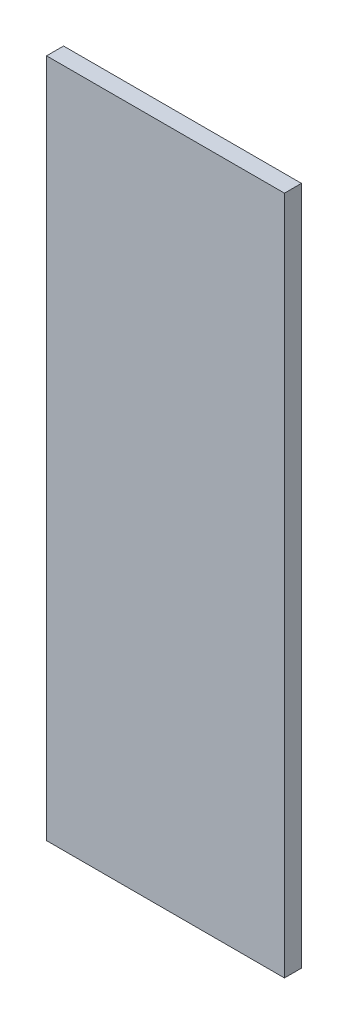
from build123d import *

# Parameters (mm, degrees)
SKETCH_1_W          = 100
SKETCH_1_H          = 200
EXTRUDE_1_DEPTH     = 5
CUT_EXTRUDE_2_DEPTH = 0.001
SKETCH_13_W         = 10
SKETCH_13_H         = 200
CUT_EXTRUDE_4_DEPTH = 10
SKETCH_14_W         = 10
SKETCH_14_H         = 200
CUT_EXTRUDE_5_DEPTH = 10


with BuildPart() as part:
    # 스케치1 → 보스-돌출1 (new body)
    with BuildSketch(Plane.XY):
        Rectangle(SKETCH_1_W, SKETCH_1_H)
    extrude(amount=EXTRUDE_1_DEPTH)

    # 스케치3 → 컷-돌출2 (cut)
    # profile 1 of 5: a face of its own
    with BuildSketch(Plane(origin=(0, 0, 0), x_dir=(-1, 0, 0), z_dir=(0, 0, -1))):
        with BuildLine():
            Line((1.435897436, 3.568709936), (1.435897436, 3.241987179))
            add(Edge.make_bspline(
                [(1.435897436, 3.241987179), (1.406158657, 3.253938052), (1.349713836, 3.276621056), (1.26647346, 3.301285681), (1.189944626, 3.317221421), (1.140790736, 3.319457366), (1.117588141, 3.320512821)],
                knots=[0, 0, 0, 0, 1.16548392, 2.212112691, 3.15604595, 4, 4, 4, 4], degree=3))
            add(Edge.make_bspline(
                [(1.117588141, 3.320512821), (1.101914377, 3.31986148), (1.071575198, 3.318600703), (1.027971871, 3.312172427), (0.988682661, 3.299069626), (0.953777041, 3.28204035), (0.924826581, 3.260686166), (0.900040357, 3.239230902), (0.882073827, 3.215045722), (0.872318879, 3.192525311), (0.866368878, 3.171674318), (0.86457875, 3.150320052), (0.860193836, 3.124095966), (0.858971029, 3.091932248), (0.856183661, 3.054829537), (0.856430302, 3.012002641), (0.854146379, 2.964125498), (0.854488293, 2.930224949), (0.854667468, 2.912459936)],
                knots=[0, 0, 0, 0, 1.311993654, 2.539582093, 3.670788641, 4.763509788, 5.772417512, 6.671800701, 7.496729179, 8.266799162, 8.712543678, 9.304149002, 10.05334463, 10.934920737, 11.99209668, 13.165090968, 14.514413552, 16, 16, 16, 16], degree=3))
            Line((0.854667468, 2.912459936), (0.854667468, 2.557692308))
            Line((0.854667468, 2.557692308), (1.391025641, 2.557692308))
            Line((1.391025641, 2.557692308), (1.391025641, 2.243589744))
            Line((1.391025641, 2.243589744), (0.853966346, 2.243589744))
            Line((0.853966346, 2.243589744), (0.852564103, 0))
            Line((0.852564103, 0), (0.538461538, 0))
            Line((0.538461538, 0), (0.538461538, 2.243589744))
            Line((0.538461538, 2.243589744), (0.179487179, 2.243589744))
            Line((0.179487179, 2.243589744), (0.179487179, 2.557692308))
            Line((0.179487179, 2.557692308), (0.538461538, 2.557692308))
            Line((0.538461538, 2.557692308), (0.538461538, 2.966446314))
            add(Edge.make_bspline(
                [(0.538461538, 2.966446314), (0.538486753, 2.989121894), (0.538535124, 3.032622798), (0.541922975, 3.095232239), (0.544818696, 3.153055703), (0.550586323, 3.205644336), (0.557248029, 3.253490479), (0.566784189, 3.29588336), (0.57579556, 3.333965119), (0.592144152, 3.377067776), (0.616566371, 3.4259178), (0.656096568, 3.4775417), (0.703489575, 3.523846647), (0.760097899, 3.562854), (0.823813434, 3.595269478), (0.894694612, 3.618511331), (0.97196981, 3.631651776), (1.02545728, 3.633605985), (1.053084936, 3.634615385)],
                knots=[0, 0, 0, 0, 1.116398763, 2.141702935, 3.087165306, 3.966655413, 4.746276475, 5.464069668, 6.106083417, 6.67047701, 7.730773247, 8.782666744, 9.856985883, 10.980834087, 12.154321827, 13.366232824, 14.639591414, 16, 16, 16, 16], degree=3))
            add(Edge.make_bspline(
                [(1.053084936, 3.634615385), (1.081161694, 3.633658004), (1.140107358, 3.631648034), (1.232303961, 3.619214627), (1.331900478, 3.597743597), (1.400236399, 3.578665712), (1.435897436, 3.568709936)],
                knots=[0, 0, 0, 0, 0.864728408, 1.815451418, 2.859995356, 4, 4, 4, 4], degree=3))
        make_face()
    # profile 2 of 5: a face of its own
    with BuildSketch(Plane(origin=(0, 0, 0), x_dir=(-1, 0, 0), z_dir=(0, 0, -1))):
        with BuildLine():
            Line((1.794871795, 2.557692308), (2.108974359, 2.557692308))
            Line((2.108974359, 2.557692308), (2.108974359, 2.181189904))
            add(Edge.make_bspline(
                [(2.108974359, 2.181189904), (2.132163118, 2.216245732), (2.176511439, 2.283289731), (2.250224368, 2.371959032), (2.325727699, 2.445374079), (2.403382887, 2.503877598), (2.483760987, 2.547690717), (2.565097938, 2.579783752), (2.648673408, 2.598761067), (2.704835332, 2.601294726), (2.732972756, 2.602564103)],
                knots=[0, 0, 0, 0, 1.2804753, 2.448899062, 3.506932113, 4.484331642, 5.4025378, 6.288909075, 7.142734305, 8, 8, 8, 8], degree=3))
            add(Edge.make_bspline(
                [(2.732972756, 2.602564103), (2.754799083, 2.601373576), (2.799708168, 2.59892399), (2.867690758, 2.581713165), (2.93773421, 2.554235143), (2.982876597, 2.52839492), (3.006410256, 2.514923878)],
                knots=[0, 0, 0, 0, 0.901110191, 1.854092781, 2.881294221, 4, 4, 4, 4], degree=3))
            Line((3.006410256, 2.514923878), (2.833934295, 2.242888622))
            add(Edge.make_bspline(
                [(2.833934295, 2.242888622), (2.818825274, 2.249628888), (2.790145459, 2.262423203), (2.748190893, 2.277565213), (2.709509556, 2.286481129), (2.684865998, 2.287831847), (2.673377404, 2.288461538)],
                knots=[0, 0, 0, 0, 1.180555205, 2.24091978, 3.179933427, 4, 4, 4, 4], degree=3))
            add(Edge.make_bspline(
                [(2.673377404, 2.288461538), (2.64817167, 2.286781501), (2.59675928, 2.283354712), (2.521274781, 2.256415904), (2.448027575, 2.212890664), (2.389855913, 2.164619552), (2.34481366, 2.118071755), (2.312673435, 2.077423352), (2.283190688, 2.031844721), (2.255020467, 1.982115037), (2.229354173, 1.927385191), (2.205399504, 1.868201977), (2.183740641, 1.804496849), (2.171390397, 1.760114328), (2.165064103, 1.737379808)],
                knots=[0, 0, 0, 0, 1.125678352, 2.296057538, 3.5422874, 4.923748041, 5.663163013, 6.437101912, 7.23742474, 8.08941207, 8.991984279, 9.93940061, 10.944477711, 12, 12, 12, 12], degree=3))
            add(Edge.make_bspline(
                [(2.165064103, 1.737379808), (2.160331709, 1.717102634), (2.149849818, 1.672190235), (2.13965828, 1.596841711), (2.129588762, 1.507818052), (2.122492143, 1.404871459), (2.115914101, 1.288259015), (2.112204019, 1.15780307), (2.109100878, 1.013369718), (2.109017812, 0.912395365), (2.108974359, 0.859575321)],
                knots=[0, 0, 0, 0, 0.566838948, 1.255505196, 2.06880316, 3.007127437, 4.065329342, 5.249902469, 6.561414163, 8, 8, 8, 8], degree=3))
            Line((2.108974359, 0.859575321), (2.108974359, 0))
            Line((2.108974359, 0), (1.794871795, 0))
            Line((1.794871795, 0), (1.794871795, 2.557692308))
        make_face()
    # profile 3 of 5: a face of its own
    with BuildSketch(Plane(origin=(0, 0, 0), x_dir=(-1, 0, 0), z_dir=(0, 0, -1))):
        with BuildLine():
            add(Edge.make_bspline(
                [(4.555889423, 2.602564103), (4.603880696, 2.601542211), (4.697979853, 2.599538533), (4.835787739, 2.578123567), (4.967332875, 2.545376203), (5.093119067, 2.500104641), (5.211535363, 2.43942269), (5.324306607, 2.367013399), (5.431123616, 2.281230805), (5.495146645, 2.214872737), (5.527644231, 2.181189904)],
                knots=[0, 0, 0, 0, 1.054011418, 2.066658804, 3.057071809, 4.030435133, 4.997543892, 5.974964718, 6.972108034, 8, 8, 8, 8], degree=3))
            add(Edge.make_bspline(
                [(5.527644231, 2.181189904), (5.555626185, 2.148975918), (5.611048565, 2.085171376), (5.682114284, 1.981715763), (5.743335844, 1.874575662), (5.792398805, 1.762328336), (5.831083829, 1.645953664), (5.858549525, 1.525051653), (5.87488646, 1.399889306), (5.877089427, 1.314885468), (5.878205128, 1.271834936)],
                knots=[0, 0, 0, 0, 1.025258237, 2.030674902, 3.01204498, 3.988269485, 4.97094183, 5.956517959, 6.965070386, 8, 8, 8, 8], degree=3))
            add(Edge.make_bspline(
                [(5.878205128, 1.271834936), (5.877223791, 1.228534878), (5.875284623, 1.142971945), (5.856941006, 1.016952579), (5.82840992, 0.894757756), (5.787578082, 0.776899063), (5.735219973, 0.663016235), (5.671329285, 0.553606686), (5.595457668, 0.448454553), (5.509453671, 0.348452714), (5.414401795, 0.2562865), (5.311285647, 0.17595823), (5.202131613, 0.107136706), (5.08548826, 0.05170029), (4.962420773, 0.00799059), (4.832663705, -0.022709427), (4.696418635, -0.04127111), (4.603391413, -0.043654684), (4.555889423, -0.044871795)],
                knots=[0, 0, 0, 0, 0.998656419, 1.973391657, 2.932242238, 3.890759089, 4.846373663, 5.82037756, 6.809684879, 7.83454468, 8.860553229, 9.859544525, 10.845671541, 11.83227036, 12.833544569, 13.85385346, 14.904124723, 16, 16, 16, 16], degree=3))
            add(Edge.make_bspline(
                [(4.555889423, -0.044871795), (4.508154704, -0.043650599), (4.414663844, -0.041258824), (4.277937862, -0.022781541), (4.147948243, 0.007976441), (4.024719644, 0.051843934), (3.907574798, 0.107138478), (3.797788301, 0.175750167), (3.694588385, 0.256310322), (3.599516401, 0.348446259), (3.513517795, 0.448456216), (3.437644787, 0.553606254), (3.373754461, 0.663016348), (3.321396257, 0.776899033), (3.280564444, 0.894757764), (3.252033351, 1.016952577), (3.233689737, 1.142971945), (3.231750568, 1.228534878), (3.230769231, 1.271834936)],
                knots=[0, 0, 0, 0, 1.099876186, 2.154163076, 3.173186993, 4.173200201, 5.163417411, 6.152872554, 7.150605724, 8.17532212, 9.198891216, 10.186952605, 11.159729845, 12.11414092, 13.071450619, 14.029093627, 15.002601286, 16, 16, 16, 16], degree=3))
            add(Edge.make_bspline(
                [(3.230769231, 1.271834936), (3.231892541, 1.314651482), (3.234116503, 1.399420884), (3.250437012, 1.524347945), (3.277795568, 1.645045334), (3.316526965, 1.76097081), (3.366042155, 1.872726246), (3.426403443, 1.980131077), (3.498194076, 2.083118877), (3.553396027, 2.146840957), (3.581330128, 2.179086538)],
                knots=[0, 0, 0, 0, 1.031353054, 2.041901799, 3.029428768, 4.008703097, 4.981709435, 5.96992636, 6.972712378, 8, 8, 8, 8], degree=3))
            add(Edge.make_bspline(
                [(3.581330128, 2.179086538), (3.613778719, 2.213061478), (3.677594583, 2.279879174), (3.784943311, 2.365411698), (3.897437132, 2.439327772), (4.017162058, 2.498803987), (4.142844916, 2.545642505), (4.275064159, 2.57820802), (4.413339674, 2.599461375), (4.507899295, 2.601519553), (4.555889423, 2.602564103)],
                knots=[0, 0, 0, 0, 1.027980169, 2.021703884, 2.998553061, 3.971491411, 4.943284454, 5.930300938, 6.949603206, 8, 8, 8, 8], degree=3))
        make_face()
        with BuildLine():
            add(Edge.make_bspline(
                [(4.554487179, 2.288461538), (4.520549568, 2.287496947), (4.453550439, 2.285592664), (4.354930855, 2.27110876), (4.259990701, 2.248161255), (4.168549857, 2.215557199), (4.080916684, 2.1734583), (3.997007282, 2.12174994), (3.916574842, 2.061116984), (3.841192779, 1.991654312), (3.772010466, 1.915775317), (3.71153249, 1.834926959), (3.660107384, 1.750420612), (3.617267225, 1.662168401), (3.585360036, 1.569275987), (3.562187014, 1.472795356), (3.547716774, 1.37252994), (3.545830395, 1.304368921), (3.544871795, 1.269731571)],
                knots=[0, 0, 0, 0, 1.021534396, 2.016698045, 2.994645724, 3.958388632, 4.93408049, 5.916473867, 6.921342795, 7.962252576, 8.998418191, 10.008913653, 10.997312074, 11.973003931, 12.956656626, 13.948281152, 14.957379055, 16, 16, 16, 16], degree=3))
            add(Edge.make_bspline(
                [(3.544871795, 1.269731571), (3.546478619, 1.224979543), (3.549667863, 1.136155138), (3.575603099, 1.005344015), (3.618989379, 0.879762163), (3.677576659, 0.760145777), (3.750982878, 0.649473499), (3.837469944, 0.550802015), (3.936109645, 0.465616203), (4.045726145, 0.394935358), (4.164080463, 0.338775602), (4.289336784, 0.298976626), (4.419977478, 0.273104934), (4.509258209, 0.270533459), (4.554487179, 0.269230769)],
                knots=[0, 0, 0, 0, 1.016792936, 2.018143844, 3.017858371, 4.030088057, 5.03801393, 6.028138512, 7.003788237, 7.991172063, 8.984598303, 9.972568034, 10.972917682, 12, 12, 12, 12], degree=3))
            add(Edge.make_bspline(
                [(4.554487179, 0.269230769), (4.599713548, 0.270541049), (4.688989144, 0.273127506), (4.819448321, 0.298846326), (4.944362293, 0.338949987), (5.062593681, 0.394872197), (5.172160284, 0.465884611), (5.271509405, 0.550320988), (5.357258017, 0.64973484), (5.430591621, 0.760292369), (5.490138364, 0.879576721), (5.533321566, 1.005367193), (5.559319152, 1.136149235), (5.562499981, 1.224977566), (5.564102564, 1.269731571)],
                knots=[0, 0, 0, 0, 1.02726834, 2.027799167, 3.010890988, 4.004497153, 4.992059811, 5.971914811, 6.958719428, 7.966827853, 8.981595046, 9.981490638, 10.983022906, 12, 12, 12, 12], degree=3))
            add(Edge.make_bspline(
                [(5.564102564, 1.269731571), (5.563144294, 1.304369128), (5.561258565, 1.372530554), (5.546783601, 1.472793007), (5.523628061, 1.569284604), (5.491656444, 1.662136607), (5.44900243, 1.750649112), (5.396585637, 1.834678839), (5.336354611, 1.916055385), (5.26633749, 1.991409026), (5.191034113, 2.061144062), (5.110569074, 2.121773452), (5.026784096, 2.173231047), (4.939405513, 2.215917288), (4.847952945, 2.247864628), (4.753145816, 2.271241259), (4.654947006, 2.285531456), (4.588187963, 2.287478598), (4.554487179, 2.288461538)],
                knots=[0, 0, 0, 0, 1.042956736, 2.052379634, 3.044323526, 4.02829302, 5.004299113, 5.996692471, 7.007513377, 8.048758398, 9.090003419, 10.095195979, 11.07790575, 12.047570684, 13.018257071, 13.989683339, 14.985167495, 16, 16, 16, 16], degree=3))
        make_face(mode=Mode.SUBTRACT)
    # profile 4 of 5: a face of its own
    with BuildSketch(Plane(origin=(0, 0, 0), x_dir=(-1, 0, 0), z_dir=(0, 0, -1))):
        with BuildLine():
            Line((6.506410256, 2.557692308), (6.820512821, 2.557692308))
            Line((6.820512821, 2.557692308), (6.820512821, 2.096354167))
            add(Edge.make_bspline(
                [(6.820512821, 2.096354167), (6.854050456, 2.13819689), (6.919131407, 2.219394153), (7.02751574, 2.326114728), (7.14205964, 2.414059953), (7.262061644, 2.484163747), (7.387684654, 2.537010373), (7.518162924, 2.575176304), (7.65427763, 2.598061132), (7.746842067, 2.601051363), (7.793669872, 2.602564103)],
                knots=[0, 0, 0, 0, 1.12780773, 2.188550248, 3.19190651, 4.159438251, 5.104880172, 6.052711206, 7.014878035, 8, 8, 8, 8], degree=3))
            add(Edge.make_bspline(
                [(7.793669872, 2.602564103), (7.841000506, 2.600818907), (7.933637974, 2.597403139), (8.068516035, 2.570386448), (8.194489429, 2.524241192), (8.311108985, 2.461029122), (8.416236198, 2.382422649), (8.508561049, 2.290844867), (8.584924297, 2.185508784), (8.63612166, 2.087785627), (8.669847307, 2.001096833), (8.691079645, 1.926850083), (8.709110626, 1.844131932), (8.724742374, 1.753192343), (8.735319486, 1.653394153), (8.743661778, 1.545146461), (8.749640472, 1.42848433), (8.749877679, 1.347797703), (8.75, 1.306189904)],
                knots=[0, 0, 0, 0, 1.235846778, 2.418850247, 3.575807741, 4.728682307, 5.871620074, 6.994088408, 8.11269785, 9.256955736, 9.865816715, 10.540099792, 11.271859618, 12.076849838, 12.949306005, 13.892391288, 14.913166135, 16, 16, 16, 16], degree=3))
            Line((8.75, 1.306189904), (8.75, 0))
            Line((8.75, 0), (8.435897436, 0))
            Line((8.435897436, 0), (8.435897436, 1.203125))
            add(Edge.make_bspline(
                [(8.435897436, 1.203125), (8.435704228, 1.237947445), (8.435334654, 1.304556856), (8.434169007, 1.399925879), (8.431359201, 1.486412457), (8.427410888, 1.563809825), (8.421631857, 1.632043661), (8.415609226, 1.691252938), (8.408244249, 1.74136248), (8.401681336, 1.771527563), (8.398737981, 1.78505609)],
                knots=[0, 0, 0, 0, 1.430800155, 2.736877192, 3.918605307, 4.986035426, 5.920637409, 6.731861385, 7.431261377, 8, 8, 8, 8], degree=3))
            add(Edge.make_bspline(
                [(8.398737981, 1.78505609), (8.388112449, 1.824767275), (8.367661589, 1.901199019), (8.317127605, 2.004873372), (8.253313425, 2.09307156), (8.175415575, 2.165248281), (8.0841865, 2.221419118), (7.979879357, 2.260393073), (7.863500716, 2.284769342), (7.781646334, 2.287196474), (7.738982372, 2.288461538)],
                knots=[0, 0, 0, 0, 1.084156227, 2.086665306, 3.027808233, 3.945421172, 4.874247719, 5.839848303, 6.874090471, 8, 8, 8, 8], degree=3))
            add(Edge.make_bspline(
                [(7.738982372, 2.288461538), (7.713714688, 2.287985534), (7.663710595, 2.287043533), (7.589560623, 2.277592235), (7.51763645, 2.262133779), (7.447216241, 2.241265142), (7.379708447, 2.212602873), (7.312944156, 2.180073502), (7.249437392, 2.13952529), (7.187833995, 2.094334669), (7.130521187, 2.044255462), (7.077192849, 1.991410952), (7.029654829, 1.935135348), (6.986586153, 1.8763354), (6.94940789, 1.814203562), (6.916954802, 1.749339256), (6.889419107, 1.681657107), (6.875736415, 1.634682046), (6.868890224, 1.611177885)],
                knots=[0, 0, 0, 0, 1.023777757, 2.026029729, 3.023749952, 4.003683103, 4.997618607, 5.993177895, 7.010360494, 8.046726602, 9.087585522, 10.09234134, 11.086953743, 12.070360549, 13.043493632, 14.017870808, 15.008233677, 16, 16, 16, 16], degree=3))
            add(Edge.make_bspline(
                [(6.868890224, 1.611177885), (6.864950576, 1.593922682), (6.856374167, 1.556359007), (6.847110987, 1.494714588), (6.838703412, 1.423404613), (6.831666453, 1.342512296), (6.827361037, 1.251754421), (6.82266664, 1.151518583), (6.820957579, 1.041405094), (6.820665225, 0.964743402), (6.820512821, 0.924779647)],
                knots=[0, 0, 0, 0, 0.615963638, 1.340920617, 2.168419149, 3.115676021, 4.16674242, 5.331190069, 6.6087489, 8, 8, 8, 8], degree=3))
            Line((6.820512821, 0.924779647), (6.820512821, 0))
            Line((6.820512821, 0), (6.506410256, 0))
            Line((6.506410256, 0), (6.506410256, 2.557692308))
        make_face()
    # profile 5 of 5: a face of its own
    with BuildSketch(Plane(origin=(0, 0, 0), x_dir=(-1, 0, 0), z_dir=(0, 0, -1))):
        Polygon((9.782051282, 3.58974359), (10.096153846, 3.58974359), (10.096153846, 2.557692308), (10.544871795, 2.557692308), (10.544871795, 2.243589744), (10.096153846, 2.243589744), (10.096153846, 0), (9.782051282, 0), (9.782051282, 2.243589744), (9.333333333, 2.243589744), (9.333333333, 2.557692308), (9.782051282, 2.557692308), align=None)
    extrude(amount=-CUT_EXTRUDE_2_DEPTH, mode=Mode.SUBTRACT)

    # 스케치13 → 컷-돌출4 (cut)
    with BuildSketch(Plane.XY.offset(5)):
        with Locations((45, 0)):
            Rectangle(SKETCH_13_W, SKETCH_13_H)
        with Locations((-45, 0)):
            Rectangle(SKETCH_13_W, SKETCH_13_H)
    extrude(amount=-CUT_EXTRUDE_4_DEPTH, mode=Mode.SUBTRACT)

    # 스케치14 → 컷-돌출5 (cut)
    with BuildSketch(Plane.XY.offset(5)):
        with Locations((35, 0)):
            Rectangle(SKETCH_14_W, SKETCH_14_H)
    extrude(amount=-CUT_EXTRUDE_5_DEPTH, mode=Mode.SUBTRACT)


solid = part.part
